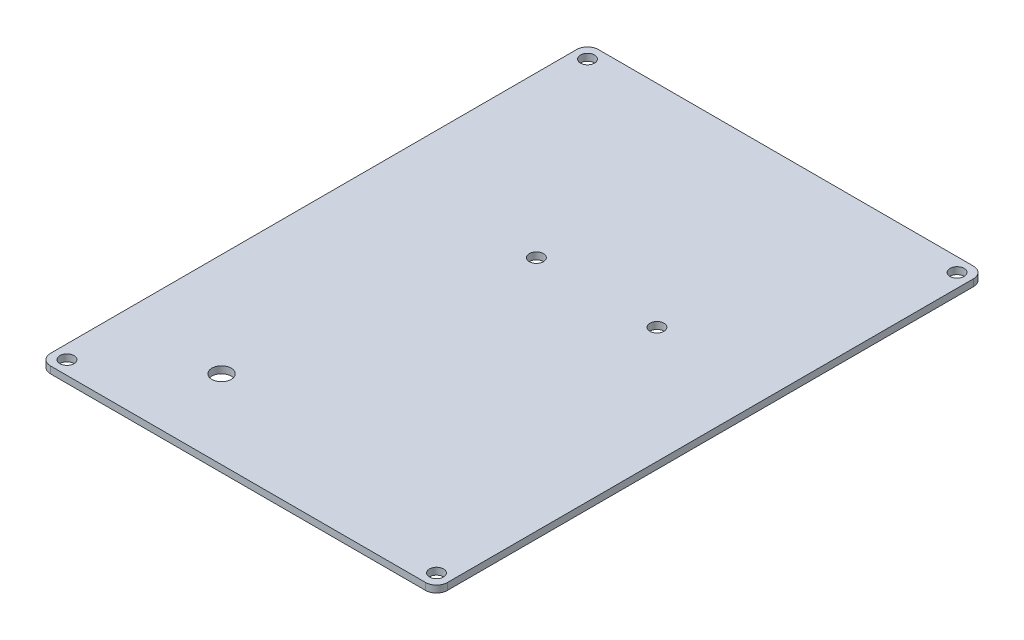
from build123d import *

# Parameters (mm, degrees)
SKETCH1_W                 = 92
SKETCH1_H                 = 127
BOSS_EXTRUDE1_DEPTH       = 1.6
F_4_CLEARANCE_HOLE2_D     = 3.2639
F_4_CLEARANCE_HOLE2_DEPTH = 50
F_4_CLEARANCE_HOLE2_TIP   = 0.980574487
FILLET1_R                 = 2.54
F_4_CLEARANCE_HOLE1_D     = 3.2639
F_4_CLEARANCE_HOLE1_DEPTH = 18.75
F_4_CLEARANCE_HOLE1_TIP   = 0.980574487
F_8_CLEARANCE_HOLE1_D     = 4.4958
F_8_CLEARANCE_HOLE1_DEPTH = 18.75
F_8_CLEARANCE_HOLE1_TIP   = 1.350674586


with BuildPart() as part:
    # Sketch1 → Boss-Extrude1 (new body)
    with BuildSketch(Plane(origin=(0, 0, 0), x_dir=(1, 0, 0), z_dir=(0, 1, 0))):
        Rectangle(SKETCH1_W, SKETCH1_H)
    extrude(amount=BOSS_EXTRUDE1_DEPTH)

    # #4 Clearance Hole2
    with Locations(Plane(origin=(0, 1.6, 0), x_dir=(1, 0, 0), z_dir=(0, 1, 0))):
        with Locations((-42.825, 60.325), (42.825, 60.325), (42.825, -60.325), (-42.825, -60.325)):
            Hole(F_4_CLEARANCE_HOLE2_D / 2, depth=F_4_CLEARANCE_HOLE2_DEPTH)
            with Locations((0, 0, -(F_4_CLEARANCE_HOLE2_DEPTH + F_4_CLEARANCE_HOLE2_TIP / 2))):  # 118° drill point
                Cone(0, F_4_CLEARANCE_HOLE2_D / 2, F_4_CLEARANCE_HOLE2_TIP, mode=Mode.SUBTRACT)

    # Fillet1
    fillet1_edges = [part.edges().sort_by_distance(p)[0] for p in [
        (46, 0.8, 63.5),
        (46, 0.8, -63.5),
        (-46, 0.8, -63.5),
        (-46, 0.8, 63.5),
    ]]
    fillet(fillet1_edges, radius=FILLET1_R)

    # #4 Clearance Hole1
    with Locations(Plane(origin=(0, 1.6, 0), x_dir=(1, 0, 0), z_dir=(0, 1, 0))):
        with Locations((19.05, 14.54), (-8.89, 14.54)):
            Hole(F_4_CLEARANCE_HOLE1_D / 2, depth=F_4_CLEARANCE_HOLE1_DEPTH)
            with Locations((0, 0, -(F_4_CLEARANCE_HOLE1_DEPTH + F_4_CLEARANCE_HOLE1_TIP / 2))):  # 118° drill point
                Cone(0, F_4_CLEARANCE_HOLE1_D / 2, F_4_CLEARANCE_HOLE1_TIP, mode=Mode.SUBTRACT)

    # #8 Clearance Hole1
    with Locations(Plane(origin=(0, 0, 0), x_dir=(-1, 0, 0), z_dir=(0, -1, 0))):
        with Locations((22.07, -45.25)):
            Hole(F_8_CLEARANCE_HOLE1_D / 2, depth=F_8_CLEARANCE_HOLE1_DEPTH)
            with Locations((0, 0, -(F_8_CLEARANCE_HOLE1_DEPTH + F_8_CLEARANCE_HOLE1_TIP / 2))):  # 118° drill point
                Cone(0, F_8_CLEARANCE_HOLE1_D / 2, F_8_CLEARANCE_HOLE1_TIP, mode=Mode.SUBTRACT)


solid = part.part
